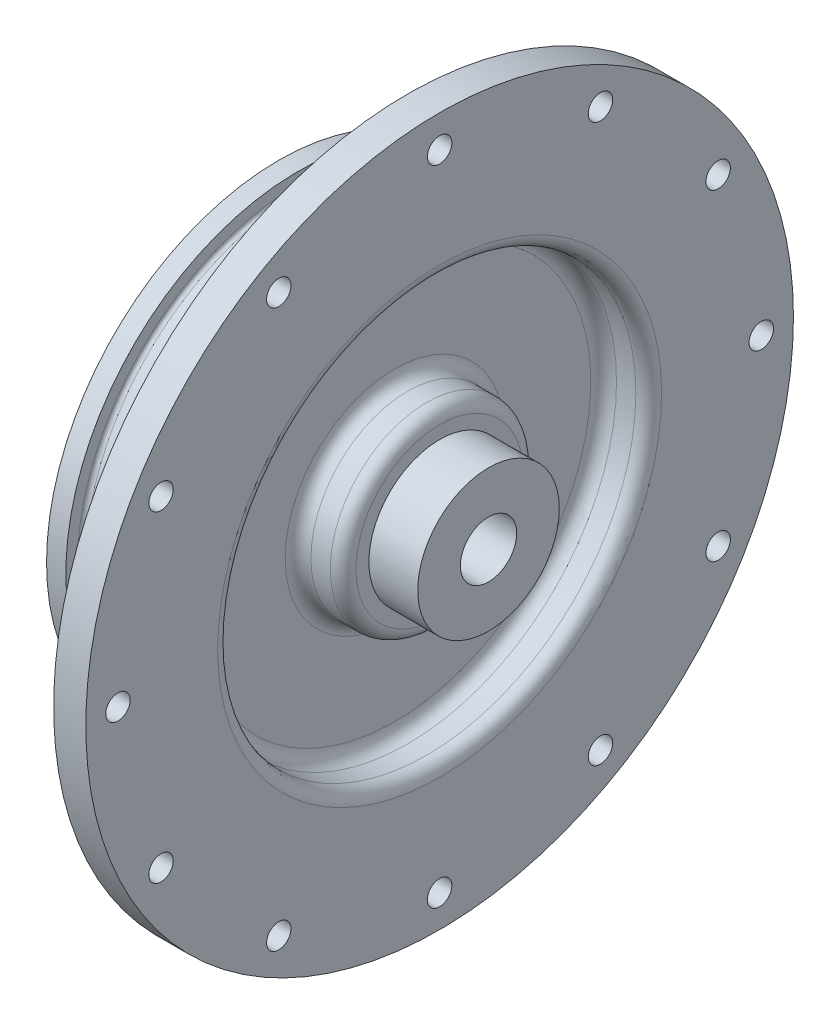
from build123d import *

# Parameters (mm, degrees)
SKETCH1_R               = 69.85
BOSS_EXTRUDE1_DEPTH     = 6.35
SKETCH2_R               = 45.847
BOSS_EXTRUDE2_DEPTH     = 25.4
SKETCH11_R              = 1.89865
CUT_EXTRUDE3_DEPTH      = 10.16
CIRPATTERN1_COUNT       = 12
CUT_EXTRUDE4_DEPTH      = 104.759854984
CUT_EXTRUDE4_DEPTH_BACK = 104.759854984
SKETCH15_R              = 5.55625
BOSS_EXTRUDE3_START     = 9.652
SKETCH17_R              = 13.97
SKETCH17_R_2            = 5.55625
BOSS_EXTRUDE3_DEPTH     = 9.652
SKETCH18_W              = 8.89
SKETCH18_H              = 22.225
FILLET1_R               = 2.54
SKETCH19_R              = 2.413
CUT_EXTRUDE5_DEPTH      = 104.759854954


with BuildPart() as part:
    # Sketch1 → Boss-Extrude1 (new body)
    with BuildSketch(Plane(origin=(0, 0, 0), x_dir=(0, 0, -1), z_dir=(1, 0, 0))):
        Circle(SKETCH1_R)
    extrude(amount=BOSS_EXTRUDE1_DEPTH)

    # Sketch2 → Boss-Extrude2 (add)
    with BuildSketch(Plane.ZY):
        Circle(SKETCH2_R)
    extrude(amount=BOSS_EXTRUDE2_DEPTH)

    # Sketch11 → Cut-Extrude3 (cut)
    with BuildSketch(Plane(origin=(0, 0, -45.847), x_dir=(-1, 0, 0), z_dir=(0, 0, -1))):
        with Locations((7.62, 0)):
            Circle(SKETCH11_R)
    cut_extrude3 = extrude(amount=-CUT_EXTRUDE3_DEPTH, mode=Mode.SUBTRACT)

    # CirPattern1: Cut-Extrude3 ×12 about axis
    cirpattern1_axis = Axis((0, 0, 0), (-1, 0, 0))
    for i in range(1, CIRPATTERN1_COUNT):
        add(cut_extrude3.rotate(cirpattern1_axis, i * 360 / CIRPATTERN1_COUNT), mode=Mode.SUBTRACT)

    # Sketch15 → Cut-Extrude4 (cut, two sides: drawn at the far end of the back side and taken through both)
    with BuildSketch(Plane(origin=(6.35, 0, 0), x_dir=(0, 0, -1), z_dir=(1, 0, 0)).offset(-CUT_EXTRUDE4_DEPTH_BACK)):
        Circle(SKETCH15_R)
    extrude(amount=CUT_EXTRUDE4_DEPTH + CUT_EXTRUDE4_DEPTH_BACK, mode=Mode.SUBTRACT)

    # Sketch16 → Cut-Revolve1 (revolve, cut)
    with BuildSketch(Plane.XY):
        with BuildLine():
            Line((-21.59, 45.847), (-14.4018, 45.847))
            Line((-14.4018, 45.847), (-14.4018, 43.6245))
            ThreePointArc((-14.4018, 43.6245), (-14.624984633, 43.085684633), (-15.1638, 42.8625))
            Line((-15.1638, 42.8625), (-20.828, 42.8625))
            ThreePointArc((-20.828, 42.8625), (-21.366815367, 43.085684633), (-21.59, 43.6245))
            Line((-21.59, 43.6245), (-21.59, 45.847))
        make_face()
    revolve(axis=Axis((0, 0, 0), (-1, 0, 0)), mode=Mode.SUBTRACT)

    # Sketch17 → Boss-Extrude3 (add)
    with BuildSketch(Plane(origin=(6.35, 0, 0), x_dir=(0, 0, -1), z_dir=(1, 0, 0)).offset(BOSS_EXTRUDE3_START)):
        Circle(SKETCH17_R)
        Circle(SKETCH17_R_2, mode=Mode.SUBTRACT)
    extrude(amount=-BOSS_EXTRUDE3_DEPTH)

    # Sketch18 → Cut-Revolve2 (revolve, cut)
    with BuildSketch(Plane.XY):
        with Locations((1.905, 30.1625)):
            Rectangle(SKETCH18_W, SKETCH18_H)
    revolve(axis=Axis((0, 0, 0), (-1, 0, 0)), mode=Mode.SUBTRACT)

    # Fillet1
    fillet1_edges = [part.edges().sort_by_distance(p)[0] for p in [
        (6.35, -41.275, 0),
        (-2.54, -41.275, 0),
        (-2.54, -19.05, 0),
        (6.35, -19.05, 0),
    ]]
    fillet(fillet1_edges, radius=FILLET1_R)

    # Sketch19 → Cut-Extrude5 (cut, through all)
    with BuildSketch(Plane(origin=(6.35, 0, 0), x_dir=(0, 0, -1), z_dir=(1, 0, 0))):
        with Locations((0, 63.5)):
            Circle(SKETCH19_R)
        with Locations((31.75, 54.99261314)):
            Circle(SKETCH19_R)
        with Locations((54.99261314, 31.75)):
            Circle(SKETCH19_R)
        with Locations((63.5, 0)):
            Circle(SKETCH19_R)
        with Locations((54.99261314, -31.75)):
            Circle(SKETCH19_R)
        with Locations((31.75, -54.99261314)):
            Circle(SKETCH19_R)
        with Locations((0, -63.5)):
            Circle(SKETCH19_R)
        with Locations((-31.75, -54.99261314)):
            Circle(SKETCH19_R)
        with Locations((-54.99261314, -31.75)):
            Circle(SKETCH19_R)
        with Locations((-63.5, 0)):
            Circle(SKETCH19_R)
        with Locations((-54.99261314, 31.75)):
            Circle(SKETCH19_R)
        with Locations((-31.75, 54.99261314)):
            Circle(SKETCH19_R)
    extrude(amount=-CUT_EXTRUDE5_DEPTH, mode=Mode.SUBTRACT)


solid = part.part
